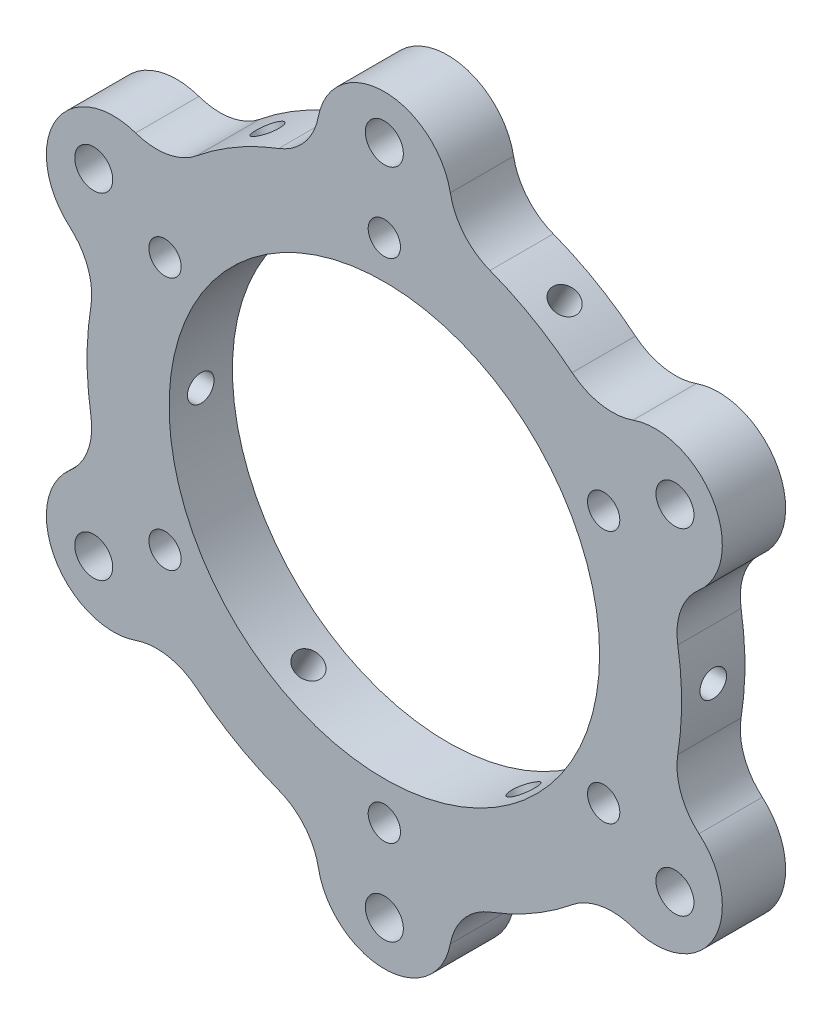
from build123d import *

# Parameters (mm, degrees)
SKETCH2_R           = 3
SKETCH2_R_2         = 2.55
SKETCH2_R_3         = 34
BOSS_EXTRUDE1_DEPTH = 10
SKETCH4_R           = 2.1
CUT_EXTRUDE1_DEPTH  = 81.929862228
CIRPATTERN1_COUNT   = 6


with BuildPart() as part:
    # Sketch2 → Boss-Extrude1 (new body)
    with BuildSketch(Plane.XY):
        with BuildLine():
            ThreePointArc((49.696632908, 16.663012041), (51.961524227, 30), (39.278908185, 34.707040561))
            ThreePointArc((39.278908185, 34.707040561), (34.249587679, 34.296880605), (29.660285602, 36.394641886))
            ThreePointArc((29.660285602, 36.394641886), (23.475, 40.659892708), (16.688541634, 43.883881758))
            ThreePointArc((16.688541634, 43.883881758), (12.577176035, 46.809453301), (10.417724723, 51.370052601))
            ThreePointArc((10.417724723, 51.370052601), (0, 60), (-10.417724723, 51.370052601))
            ThreePointArc((-10.417724723, 51.370052601), (-12.577176035, 46.809453301), (-16.688541634, 43.883881758))
            ThreePointArc((-16.688541634, 43.883881758), (-23.475, 40.659892708), (-29.660285602, 36.394641886))
            ThreePointArc((-29.660285602, 36.394641886), (-34.249587679, 34.296880605), (-39.278908185, 34.707040561))
            ThreePointArc((-39.278908185, 34.707040561), (-51.961524227, 30), (-49.696632908, 16.663012041))
            ThreePointArc((-49.696632908, 16.663012041), (-46.826763714, 12.512572696), (-46.348827236, 7.489239872))
            ThreePointArc((-46.348827236, 7.489239872), (-46.95, 0), (-46.348827236, -7.489239872))
            ThreePointArc((-46.348827236, -7.489239872), (-46.826763714, -12.512572696), (-49.696632908, -16.663012041))
            ThreePointArc((-49.696632908, -16.663012041), (-51.961524227, -30), (-39.278908185, -34.707040561))
            ThreePointArc((-39.278908185, -34.707040561), (-34.249587679, -34.296880605), (-29.660285602, -36.394641886))
            ThreePointArc((-29.660285602, -36.394641886), (-23.475, -40.659892708), (-16.688541634, -43.883881758))
            ThreePointArc((-16.688541634, -43.883881758), (-12.577176035, -46.809453301), (-10.417724723, -51.370052601))
            ThreePointArc((-10.417724723, -51.370052601), (0, -60), (10.417724723, -51.370052601))
            ThreePointArc((10.417724723, -51.370052601), (12.577176035, -46.809453301), (16.688541634, -43.883881758))
            ThreePointArc((16.688541634, -43.883881758), (23.475, -40.659892708), (29.660285602, -36.394641886))
            ThreePointArc((29.660285602, -36.394641886), (34.249587679, -34.296880605), (39.278908185, -34.707040561))
            ThreePointArc((39.278908185, -34.707040561), (51.961524227, -30), (49.696632908, -16.663012041))
            ThreePointArc((49.696632908, -16.663012041), (46.826763714, -12.512572696), (46.348827236, -7.489239872))
            ThreePointArc((46.348827236, -7.489239872), (46.95, 0), (46.348827236, 7.489239872))
            ThreePointArc((46.348827236, 7.489239872), (46.826763714, 12.512572696), (49.696632908, 16.663012041))
        make_face()
        with Locations((45.899346401, 26.5)):
            Circle(SKETCH2_R, mode=Mode.SUBTRACT)
        with Locations((0, 53)):
            Circle(SKETCH2_R, mode=Mode.SUBTRACT)
        with Locations((-34.641016151, -20)):
            Circle(SKETCH2_R_2, mode=Mode.SUBTRACT)
        with Locations((0, -40)):
            Circle(SKETCH2_R_2, mode=Mode.SUBTRACT)
        with Locations((34.641016151, -20)):
            Circle(SKETCH2_R_2, mode=Mode.SUBTRACT)
        with Locations((-34.641016151, 20)):
            Circle(SKETCH2_R_2, mode=Mode.SUBTRACT)
        with Locations((0, 40)):
            Circle(SKETCH2_R_2, mode=Mode.SUBTRACT)
        Circle(SKETCH2_R_3, mode=Mode.SUBTRACT)
        with Locations((34.641016151, 20)):
            Circle(SKETCH2_R_2, mode=Mode.SUBTRACT)
        with Locations((45.899346401, -26.5)):
            Circle(SKETCH2_R, mode=Mode.SUBTRACT)
        with Locations((0, -53)):
            Circle(SKETCH2_R, mode=Mode.SUBTRACT)
        with Locations((-45.899346401, -26.5)):
            Circle(SKETCH2_R, mode=Mode.SUBTRACT)
        with Locations((-45.899346401, 26.5)):
            Circle(SKETCH2_R, mode=Mode.SUBTRACT)
    extrude(amount=BOSS_EXTRUDE1_DEPTH)

    # Sketch4 → Cut-Extrude1 (cut, symmetric)
    with BuildSketch(Plane(origin=(0, 0, 0), x_dir=(0, 0, -1), z_dir=(-0.500000000000001, 0.866025403784438, 0))):
        with Locations((-5, 0)):
            Circle(SKETCH4_R)
    cut_extrude1 = extrude(amount=CUT_EXTRUDE1_DEPTH, both=True, mode=Mode.SUBTRACT)

    # CirPattern1: Cut-Extrude1 ×6 about axis
    cirpattern1_axis = Axis((0, 0, 16.500840286), (0, 0, -1))
    for i in range(1, CIRPATTERN1_COUNT):
        add(cut_extrude1.rotate(cirpattern1_axis, i * 360 / CIRPATTERN1_COUNT), mode=Mode.SUBTRACT)


solid = part.part
